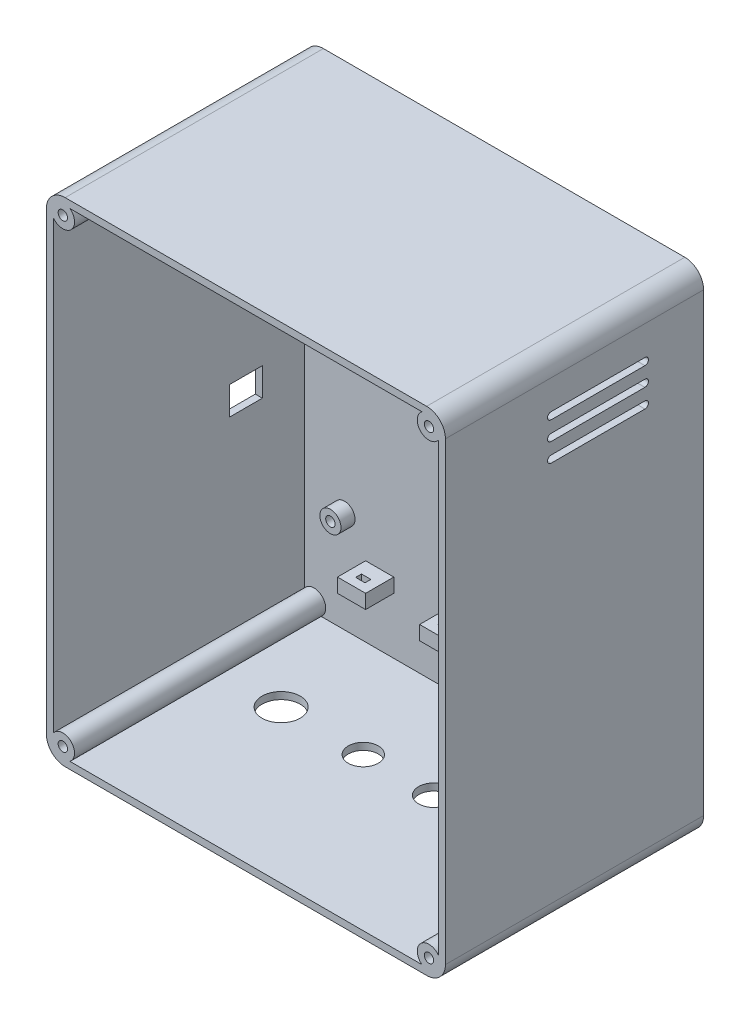
from build123d import *

# Parameters (mm, degrees)
BLOCK_DEPTH                    = 110
SHELL1_T                       = -3
SKETCH2_R                      = 5
CORNER_COLUMNS_DEPTH           = 110
SKETCH3_R                      = 2
FRONT_PANEL_INSERT_HOLES_DEPTH = 7
SKETCH4_R                      = 4.5
PLATE_BOSSES_DEPTH             = 6
SKETCH5_R                      = 2
PLATE_INSERT_HOLES_DEPTH       = 7
SKETCH6_R                      = 8.15
SKETCH6_R_2                    = 6.4
CABLE_GLAND_HOLES_DEPTH        = 4
SKETCH7_W                      = 12
SKETCH7_H                      = 6
CABLE_TIE_BARS_DEPTH           = 12
SKETCH8_W                      = 4
SKETCH8_H                      = 2.5
CABLE_TIE_SLOTS_DEPTH          = 6.02
SKETCH9_W                      = 14
SKETCH9_H                      = 12
USB_ACCESS_DEPTH               = 4
VENTS_LEFT_DEPTH               = 4
VENTS_START                    = -4
VENTS_RIGHT_DEPTH              = 4
SKETCH12_R                     = 4.75
KEYHOLE_HEADS_DEPTH            = 4
KEYHOLE_SLOTS_DEPTH            = 4


with BuildPart() as part:
    # Sketch1 → Block (new body)
    with BuildSketch(Plane.XY):
        with BuildLine():
            Line((-77, 0), (77, 0))
            ThreePointArc((77, 0), (82.656854249, 2.343145751), (85, 8))
            Line((85, 8), (85, 202))
            ThreePointArc((85, 202), (82.656854249, 207.656854249), (77, 210))
            Line((77, 210), (-77, 210))
            ThreePointArc((-77, 210), (-82.656854249, 207.656854249), (-85, 202))
            Line((-85, 202), (-85, 8))
            ThreePointArc((-85, 8), (-82.656854249, 2.343145751), (-77, 0))
        make_face()
    extrude(amount=BLOCK_DEPTH)

    # Shell1
    shell1_openings = [part.faces().sort_by_distance(p)[0] for p in [
        (0, 105, 110),
    ]]
    offset(amount=SHELL1_T, openings=shell1_openings, kind=Kind.INTERSECTION)

    # Sketch2 → Corner columns (add)
    with BuildSketch(Plane.XY):
        with Locations((-78, 7)):
            Circle(SKETCH2_R)
        with Locations((78, 7)):
            Circle(SKETCH2_R)
        with Locations((-78, 203)):
            Circle(SKETCH2_R)
        with Locations((78, 203)):
            Circle(SKETCH2_R)
    extrude(amount=CORNER_COLUMNS_DEPTH)

    # Sketch3 → Front panel insert holes (cut)
    with BuildSketch(Plane.XY.offset(110)):
        with Locations((-78, 7)):
            Circle(SKETCH3_R)
        with Locations((78, 7)):
            Circle(SKETCH3_R)
        with Locations((-78, 203)):
            Circle(SKETCH3_R)
        with Locations((78, 203)):
            Circle(SKETCH3_R)
    extrude(amount=-FRONT_PANEL_INSERT_HOLES_DEPTH, mode=Mode.SUBTRACT)

    # Sketch4 → Plate bosses (add)
    with BuildSketch(Plane.XY.offset(3)):
        with Locations((-65, 46)):
            Circle(SKETCH4_R)
        with Locations((65, 46)):
            Circle(SKETCH4_R)
        with Locations((-65, 190)):
            Circle(SKETCH4_R)
        with Locations((65, 190)):
            Circle(SKETCH4_R)
    extrude(amount=PLATE_BOSSES_DEPTH)

    # Sketch5 → Plate insert holes (cut)
    with BuildSketch(Plane.XY.offset(9)):
        with Locations((-65, 46)):
            Circle(SKETCH5_R)
        with Locations((65, 46)):
            Circle(SKETCH5_R)
        with Locations((-65, 190)):
            Circle(SKETCH5_R)
        with Locations((65, 190)):
            Circle(SKETCH5_R)
    extrude(amount=-PLATE_INSERT_HOLES_DEPTH, mode=Mode.SUBTRACT)

    # Sketch6 → Cable gland holes (cut)
    with BuildSketch(Plane(origin=(0, 0, 0), x_dir=(1, 0, 0), z_dir=(0, 1, 0))):
        with Locations((-50, -45)):
            Circle(SKETCH6_R)
        with Locations((-15, -45)):
            Circle(SKETCH6_R_2)
        with Locations((15, -45)):
            Circle(SKETCH6_R_2)
        with Locations((50, -45)):
            Circle(SKETCH6_R_2)
    extrude(amount=CABLE_GLAND_HOLES_DEPTH, mode=Mode.SUBTRACT)

    # Sketch7 → Cable tie bars (add)
    with BuildSketch(Plane.XY.offset(3)):
        with Locations((-50, 30)):
            Rectangle(SKETCH7_W, SKETCH7_H)
        with Locations((-15, 30)):
            Rectangle(SKETCH7_W, SKETCH7_H)
        with Locations((15, 30)):
            Rectangle(SKETCH7_W, SKETCH7_H)
        with Locations((50, 30)):
            Rectangle(SKETCH7_W, SKETCH7_H)
    extrude(amount=CABLE_TIE_BARS_DEPTH)

    # Sketch8 → Cable tie slots (cut)
    with BuildSketch(Plane(origin=(0, 26.99, 0), x_dir=(1, 0, 0), z_dir=(0, 1, 0))):
        with Locations((-50, -10)):
            Rectangle(SKETCH8_W, SKETCH8_H)
        with Locations((-15, -10)):
            Rectangle(SKETCH8_W, SKETCH8_H)
        with Locations((15, -10)):
            Rectangle(SKETCH8_W, SKETCH8_H)
        with Locations((50, -10)):
            Rectangle(SKETCH8_W, SKETCH8_H)
    extrude(amount=CABLE_TIE_SLOTS_DEPTH, mode=Mode.SUBTRACT)

    # Sketch9 → USB access (cut)
    with BuildSketch(Plane(origin=(-85, 0, 0), x_dir=(0, 0, -1), z_dir=(1, 0, 0))):
        with Locations((-28, 95)):
            Rectangle(SKETCH9_W, SKETCH9_H)
    extrude(amount=USB_ACCESS_DEPTH, mode=Mode.SUBTRACT)

    # Sketch10 → Vents left (cut)
    with BuildSketch(Plane(origin=(-85, 0, 0), x_dir=(0, 0, -1), z_dir=(1, 0, 0))):
        with BuildLine():
            Line((-25, 170.5), (-65, 170.5))
            ThreePointArc((-65, 170.5), (-66.5, 172), (-65, 173.5))
            Line((-65, 173.5), (-25, 173.5))
            ThreePointArc((-25, 173.5), (-23.5, 172), (-25, 170.5))
        make_face()
        with BuildLine():
            Line((-25, 178.5), (-65, 178.5))
            ThreePointArc((-65, 178.5), (-66.5, 180), (-65, 181.5))
            Line((-65, 181.5), (-25, 181.5))
            ThreePointArc((-25, 181.5), (-23.5, 180), (-25, 178.5))
        make_face()
        with BuildLine():
            Line((-25, 186.5), (-65, 186.5))
            ThreePointArc((-65, 186.5), (-66.5, 188), (-65, 189.5))
            Line((-65, 189.5), (-25, 189.5))
            ThreePointArc((-25, 189.5), (-23.5, 188), (-25, 186.5))
        make_face()
    extrude(amount=VENTS_LEFT_DEPTH, mode=Mode.SUBTRACT)

    # Sketch11 → Vents right (cut)
    with BuildSketch(Plane(origin=(85, 0, 0), x_dir=(0, 0, -1), z_dir=(1, 0, 0)).offset(VENTS_START)):
        with BuildLine():
            Line((-25, 170.5), (-65, 170.5))
            ThreePointArc((-65, 170.5), (-66.5, 172), (-65, 173.5))
            Line((-65, 173.5), (-25, 173.5))
            ThreePointArc((-25, 173.5), (-23.5, 172), (-25, 170.5))
        make_face()
        with BuildLine():
            Line((-25, 178.5), (-65, 178.5))
            ThreePointArc((-65, 178.5), (-66.5, 180), (-65, 181.5))
            Line((-65, 181.5), (-25, 181.5))
            ThreePointArc((-25, 181.5), (-23.5, 180), (-25, 178.5))
        make_face()
        with BuildLine():
            Line((-25, 186.5), (-65, 186.5))
            ThreePointArc((-65, 186.5), (-66.5, 188), (-65, 189.5))
            Line((-65, 189.5), (-25, 189.5))
            ThreePointArc((-25, 189.5), (-23.5, 188), (-25, 186.5))
        make_face()
    extrude(amount=VENTS_RIGHT_DEPTH, mode=Mode.SUBTRACT)

    # Sketch12 → Keyhole heads (cut)
    with BuildSketch(Plane.XY):
        with Locations((-45, 165)):
            Circle(SKETCH12_R)
        with Locations((45, 165)):
            Circle(SKETCH12_R)
    extrude(amount=KEYHOLE_HEADS_DEPTH, mode=Mode.SUBTRACT)

    # Sketch13 → Keyhole slots (cut)
    with BuildSketch(Plane.XY):
        with BuildLine():
            Line((-47.15, 165), (-47.15, 176))
            ThreePointArc((-47.15, 176), (-45, 178.15), (-42.85, 176))
            Line((-42.85, 176), (-42.85, 165))
            ThreePointArc((-42.85, 165), (-45, 162.85), (-47.15, 165))
        make_face()
        with BuildLine():
            Line((42.85, 165), (42.85, 176))
            ThreePointArc((42.85, 176), (45, 178.15), (47.15, 176))
            Line((47.15, 176), (47.15, 165))
            ThreePointArc((47.15, 165), (45, 162.85), (42.85, 165))
        make_face()
    extrude(amount=KEYHOLE_SLOTS_DEPTH, mode=Mode.SUBTRACT)


solid = part.part
